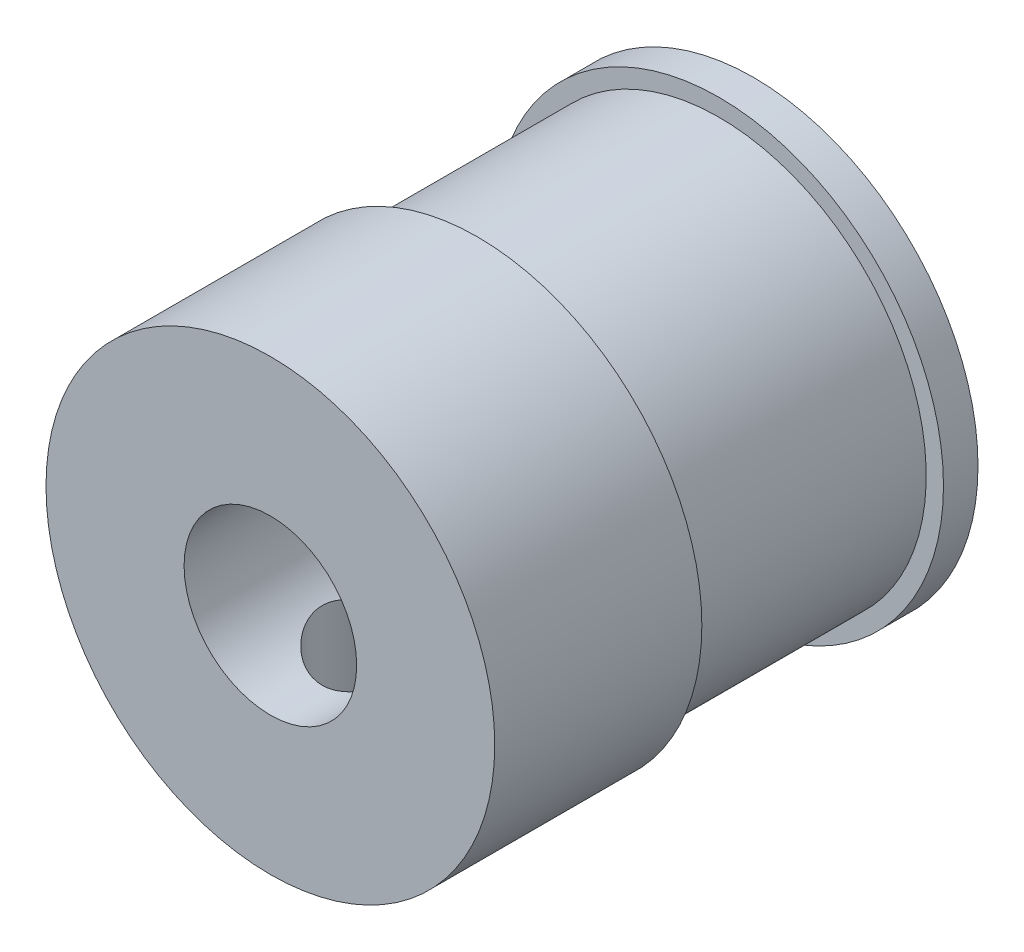
from build123d import *

# Parameters (mm, degrees)
SKETCH1_R           = 6.5
BOSS_EXTRUDE1_DEPTH = 14
SKETCH2_R           = 2.5
CUT_EXTRUDE1_DEPTH  = 17.748134224
SKETCH3_R           = 6.5
SKETCH3_R_2         = 6
CUT_EXTRUDE2_DEPTH  = 7
SKETCH4_R           = 1.5
CUT_EXTRUDE3_DEPTH  = 7


with BuildPart() as part:
    # Sketch1 → Boss-Extrude1 (new body)
    with BuildSketch(Plane.XY):
        Circle(SKETCH1_R)
    extrude(amount=BOSS_EXTRUDE1_DEPTH)

    # Sketch2 → Cut-Extrude1 (cut, through all)
    with BuildSketch(Plane.XY.offset(14)):
        Circle(SKETCH2_R)
    extrude(amount=-CUT_EXTRUDE1_DEPTH, mode=Mode.SUBTRACT)

    # Sketch3 → Cut-Extrude2 (cut)
    with BuildSketch(Plane(origin=(0, 0, 1), x_dir=(-1, 0, 0), z_dir=(0, 0, -1))):
        Circle(SKETCH3_R)
        Circle(SKETCH3_R_2, mode=Mode.SUBTRACT)
    extrude(amount=-CUT_EXTRUDE2_DEPTH, mode=Mode.SUBTRACT)

    # Sketch4 → Cut-Extrude3 (cut)
    with BuildSketch(Plane(origin=(0, 0, 0), x_dir=(1, 0, 0), z_dir=(0, 1, 0))):
        with Locations((0, -11)):
            Circle(SKETCH4_R)
    extrude(amount=-CUT_EXTRUDE3_DEPTH, mode=Mode.SUBTRACT)


solid = part.part
